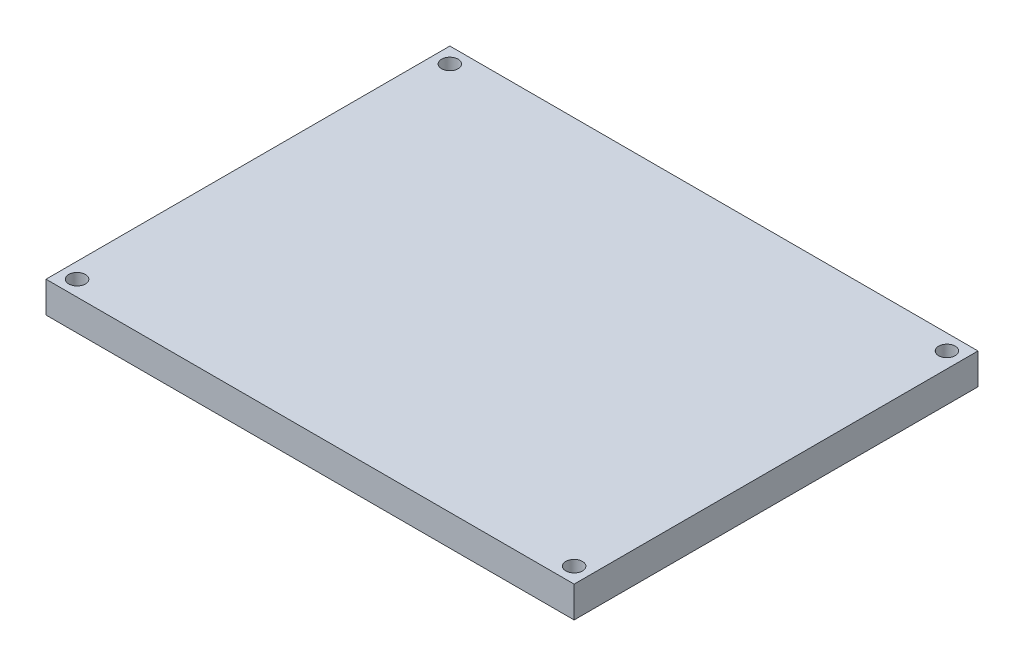
from build123d import *

# Parameters (mm, degrees)
SKETCH1_W            = 107.95
SKETCH1_H            = 82.55
BOSS_EXTRUDE1_DEPTH  = 6.35
M3_CLEARANCE_HOLE1_D = 3.4


with BuildPart() as part:
    # Sketch1 → Boss-Extrude1 (new body)
    with BuildSketch(Plane(origin=(0, 0, 0), x_dir=(1, 0, 0), z_dir=(0, 1, 0))):
        Rectangle(SKETCH1_W, SKETCH1_H)
    extrude(amount=BOSS_EXTRUDE1_DEPTH)

    # M3 Clearance Hole1 (through all)
    with Locations(Plane(origin=(-50.8, 0, 38.1), x_dir=(0, 0, -1), z_dir=(0, -1, 0))):
        with Locations((0, 0), (0, 101.6), (76.2, 0), (76.2, 101.6)):
            Hole(M3_CLEARANCE_HOLE1_D / 2)


solid = part.part
